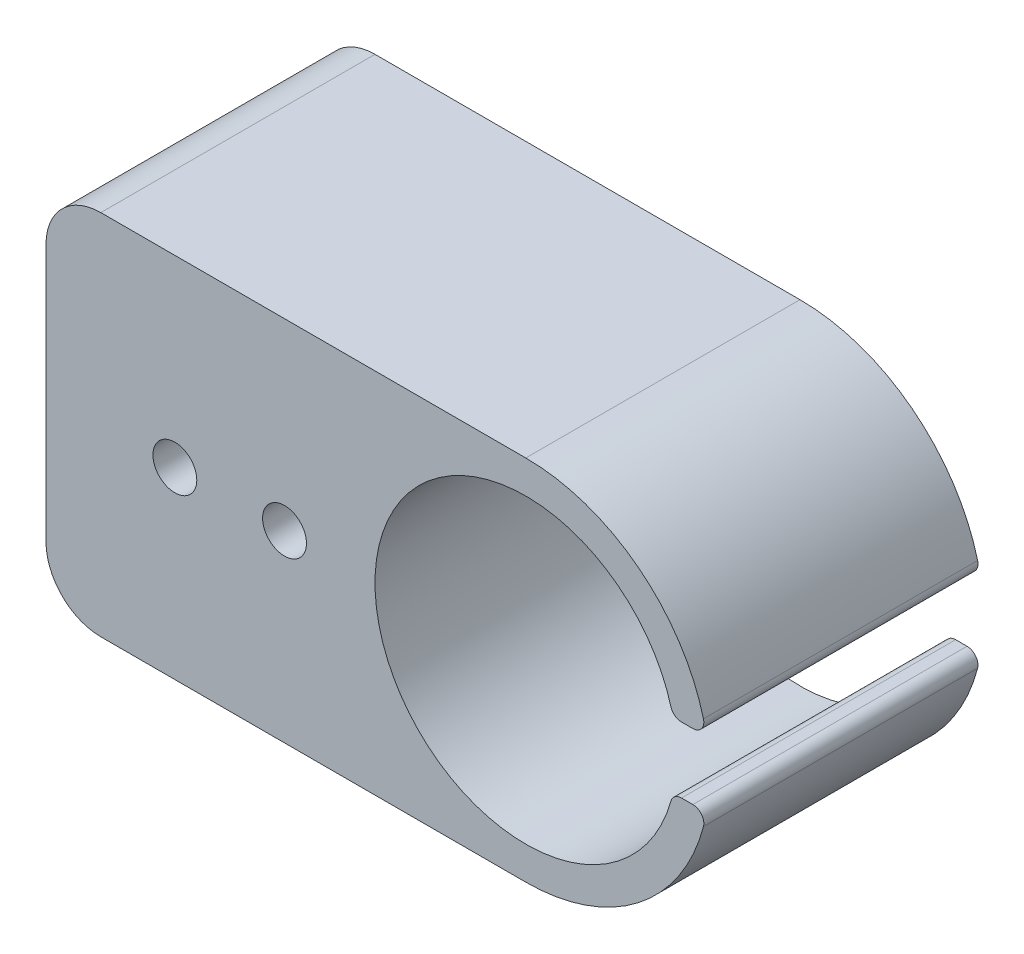
from build123d import *

# Parameters (mm, degrees)
ESQUISSE1_R             = 2
BOSS_EXTRU_1_DEPTH      = 25
ESQUISSE5_R             = 2
ENL_V_MAT_EXTRU_2_DEPTH = 10
CONG_1_R                = 5
CONG_2_R                = 1


with BuildPart() as part:
    # Esquisse1 → Boss.-Extru.1 (new body)
    with BuildSketch(Plane.XY):
        with BuildLine():
            Line((13.4187369, 3), (16.479153498, 3))
            ThreePointArc((16.479153498, 3), (10.731088016, 12.861036117), (0, 16.75))
            Line((0, 16.75), (-43.75, 16.75))
            Line((-43.75, 16.75), (-43.75, -16.75))
            Line((-43.75, -16.75), (0, -16.75))
            ThreePointArc((0, -16.75), (10.731088016, -12.861036117), (16.479153498, -3))
            Line((16.479153498, -3), (13.4187369, -3))
            ThreePointArc((13.4187369, -3), (-13.75, 0), (13.4187369, 3))
        make_face()
        with Locations((-32, 0)):
            Circle(ESQUISSE1_R, mode=Mode.SUBTRACT)
        with Locations((-22, 0)):
            Circle(ESQUISSE1_R, mode=Mode.SUBTRACT)
    extrude(amount=BOSS_EXTRU_1_DEPTH)

    # Esquisse5 → Enlèv. mat.-Extru.2 (cut)
    with BuildSketch(Plane.ZY.offset(43.75)):
        with Locations((7.5, 0)):
            Circle(ESQUISSE5_R)
        with Locations((17.5, 0)):
            Circle(ESQUISSE5_R)
    extrude(amount=-ENL_V_MAT_EXTRU_2_DEPTH, mode=Mode.SUBTRACT)

    # Congé1
    cong_1_edges = [part.edges().sort_by_distance(p)[0] for p in [
        (-43.75, -16.75, 12.5),
        (-43.75, 16.75, 12.5),
    ]]
    fillet(cong_1_edges, radius=CONG_1_R)

    # Congé2
    cong_2_edges = [part.edges().sort_by_distance(p)[0] for p in [
        (16.479153498, -3, 12.5),
        (16.479153498, 3, 12.5),
        (13.4187369, -3, 12.5),
        (13.4187369, 3, 12.5),
    ]]
    fillet(cong_2_edges, radius=CONG_2_R)


solid = part.part
